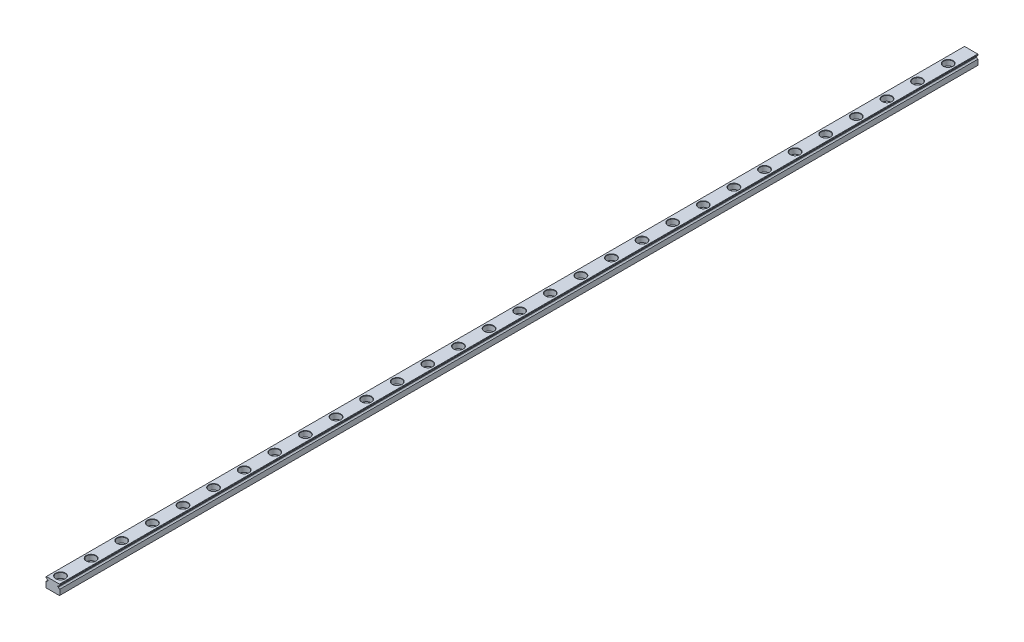
from build123d import *

# Parameters (mm, degrees)
EXTRUDE1_DEPTH             = 600
EXTRUDE2_REACH             = 602.052
SKETCH2_R                  = 1.75
SKETCH_R                   = 3
SKETCH_R_2                 = 1.75
EXTRUDE4_DEPTH             = 3.5
CHAMFER1_SIZE              = 0.2
LPATTERN1_COUNT            = 30
LPATTERN1_PITCH            = 20
CHAMFER1_OF_LPATTERN1_SIZE = 0.2


with BuildPart() as part:
    # Sketch1 → Extrude1 (new body)
    with BuildSketch(Plane.XY):
        with BuildLine():
            Line((-4.3, -3.25), (4.3, -3.25))
            Line((4.3, -3.25), (4.5, -3.05))
            Line((4.5, -3.05), (4.5, 0.455012563))
            ThreePointArc((4.5, 0.455012563), (3.924845827, 0.712323349), (3.617735397, 1.2625))
            Line((3.617735397, 1.2625), (3.15008224, 1.2625))
            Line((3.15008224, 1.2625), (3.15008224, 1.7625))
            Line((3.15008224, 1.7625), (3.65008224, 1.7625))
            ThreePointArc((3.65008224, 1.7625), (3.973877727, 2.229724887), (4.5, 2.444987437))
            Line((4.5, 2.444987437), (4.5, 3.05))
            Line((4.5, 3.05), (4.3, 3.25))
            Line((4.3, 3.25), (-4.3, 3.25))
            Line((-4.3, 3.25), (-4.5, 3.05))
            Line((-4.5, 3.05), (-4.5, 2.444987437))
            ThreePointArc((-4.5, 2.444987437), (-3.973877727, 2.229724887), (-3.65008224, 1.7625))
            Line((-3.65008224, 1.7625), (-3.15008224, 1.7625))
            Line((-3.15008224, 1.7625), (-3.15008224, 1.2625))
            Line((-3.15008224, 1.2625), (-3.617735397, 1.2625))
            ThreePointArc((-3.617735397, 1.2625), (-3.924845827, 0.712323349), (-4.5, 0.455012563))
            Line((-4.5, 0.455012563), (-4.5, -3.05))
            Line((-4.5, -3.05), (-4.3, -3.25))
        make_face()
    extrude(amount=EXTRUDE1_DEPTH)

    # Sketch2 → Extrude2 (cut, up to next)
    with BuildSketch(Plane(origin=(0, 3.25, 0), x_dir=(1, 0, 0), z_dir=(0, 1, 0)), mode=Mode.PRIVATE) as extrude2_sk1:
        with Locations((0, -15)):
            Circle(SKETCH2_R)
    extrude2_tool1 = extrude(extrude2_sk1.sketch, amount=-EXTRUDE2_REACH, mode=Mode.PRIVATE) & part.part
    extrude2 = extrude2_tool1.solids().sort_by_distance((0, 3.25, 15))[0]
    add(extrude2, mode=Mode.SUBTRACT)

    # Sketch → Extrude4 (cut)
    with BuildSketch(Plane(origin=(0, 3.25, 0), x_dir=(1, 0, 0), z_dir=(0, 1, 0))):
        with Locations((0, -15)):
            Circle(SKETCH_R)
        with Locations((0, -15)):
            Circle(SKETCH_R_2, mode=Mode.SUBTRACT)
    extrude4 = extrude(amount=-EXTRUDE4_DEPTH, mode=Mode.SUBTRACT)

    # Chamfer1
    chamfer1_edges = [part.edges().sort_by_distance(p)[0] for p in [
        (-1.75, -3.25, 15),
        (-3, 3.25, 15),
    ]]
    chamfer(chamfer1_edges, length=CHAMFER1_SIZE)

    # LPattern1: Extrude2, Extrude4 ×30
    with Locations(*[(0, 0, i * LPATTERN1_PITCH) for i in range(1, LPATTERN1_COUNT)]):
        add(extrude2, mode=Mode.SUBTRACT)
        add(extrude4, mode=Mode.SUBTRACT)

    # Chamfer1 of LPattern1
    chamfer1_of_lpattern1_edges = [part.edges().sort_by_distance(p)[0] for p in [
        (-1.75, -3.25, 35),
        (-3, 3.25, 35),
        (-1.75, -3.25, 55),
        (-3, 3.25, 55),
        (-1.75, -3.25, 75),
        (-3, 3.25, 75),
        (-1.75, -3.25, 95),
        (-3, 3.25, 95),
        (-1.75, -3.25, 115),
        (-3, 3.25, 115),
        (-1.75, -3.25, 135),
        (-3, 3.25, 135),
        (-1.75, -3.25, 155),
        (-3, 3.25, 155),
        (-1.75, -3.25, 175),
        (-3, 3.25, 175),
        (-1.75, -3.25, 195),
        (-3, 3.25, 195),
        (-1.75, -3.25, 215),
        (-3, 3.25, 215),
        (-1.75, -3.25, 235),
        (-3, 3.25, 235),
        (-1.75, -3.25, 255),
        (-3, 3.25, 255),
        (-1.75, -3.25, 275),
        (-3, 3.25, 275),
        (-1.75, -3.25, 295),
        (-3, 3.25, 295),
        (-1.75, -3.25, 315),
        (-3, 3.25, 315),
        (-1.75, -3.25, 335),
        (-3, 3.25, 335),
        (-1.75, -3.25, 355),
        (-3, 3.25, 355),
        (-1.75, -3.25, 375),
        (-3, 3.25, 375),
        (-1.75, -3.25, 395),
        (-3, 3.25, 395),
        (-1.75, -3.25, 415),
        (-3, 3.25, 415),
        (-1.75, -3.25, 435),
        (-3, 3.25, 435),
        (-1.75, -3.25, 455),
        (-3, 3.25, 455),
        (-1.75, -3.25, 475),
        (-3, 3.25, 475),
        (-1.75, -3.25, 495),
        (-3, 3.25, 495),
        (-1.75, -3.25, 515),
        (-3, 3.25, 515),
        (-1.75, -3.25, 535),
        (-3, 3.25, 535),
        (-1.75, -3.25, 555),
        (-3, 3.25, 555),
        (-1.75, -3.25, 575),
        (-3, 3.25, 575),
        (-1.75, -3.25, 595),
        (-3, 3.25, 595),
    ]]
    chamfer(chamfer1_of_lpattern1_edges, length=CHAMFER1_OF_LPATTERN1_SIZE)


solid = part.part
